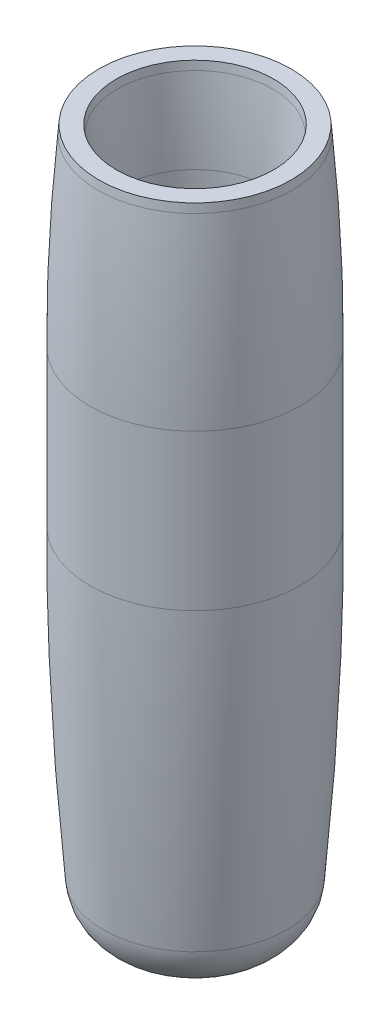
from build123d import *

# Parameters (mm, degrees)
SKETCH1_R           = 6
BOSS_EXTRUDE1_DEPTH = 5
SKETCH2_R           = 6
SKETCH2_R_2         = 4.25
BOSS_EXTRUDE2_DEPTH = 35
CHAMFER1_SIZE       = 1
CHAMFER1_SIZE2      = 11.430052303
FILLET1_R           = 200
CHAMFER2_SIZE       = 0.25
CHAMFER2_SIZE2      = 2.857513076
CHAMFER3_SIZE       = 0.5
CHAMFER3_SIZE2      = 5.715026151
FILLET3_R           = 120
FILLET4_R           = 3


with BuildPart() as part:
    # Sketch1 → Boss-Extrude1 (new body)
    with BuildSketch(Plane(origin=(0, 0, 0), x_dir=(1, 0, 0), z_dir=(0, 1, 0))):
        with Locations(Location((0, 0, 0), (0, 0, 270))):
            Circle(SKETCH1_R)
    extrude(amount=BOSS_EXTRUDE1_DEPTH)

    # Sketch2 → Boss-Extrude2 (add)
    with BuildSketch(Plane(origin=(0, 5, 0), x_dir=(1, 0, 0), z_dir=(0, 1, 0))):
        with Locations(Location((0, 0, 0), (0, 0, 270))):
            Circle(SKETCH2_R)
        with Locations(Location((0, 0, 0), (0, 0, 270))):
            Circle(SKETCH2_R_2, mode=Mode.SUBTRACT)
    extrude(amount=BOSS_EXTRUDE2_DEPTH)

    # Chamfer1
    chamfer1_edges = [part.edges().sort_by_distance(p)[0] for p in [
        (0, 0, -6),
    ]]
    chamfer1_side = [part.faces().sort_by_distance(p)[0] for p in [
        (0, 0, 0),
    ]]
    chamfer(chamfer1_edges, length=CHAMFER1_SIZE, length2=CHAMFER1_SIZE2, reference=chamfer1_side[0])

    # Fillet1
    # the kernel refuses this fillet: 200 mm, written as the material it takes off along each edge
    with BuildSketch(Plane(origin=(0, 11.430052303, 0), x_dir=(0, 0, 1), z_dir=(-1, 0, 0))) as fillet1_piece_1:
        with BuildLine():
            CenterArc((6 - FILLET1_R, FILLET1_R * 0.0436609429085), FILLET1_R, 355, 5)
            Line((6 - FILLET1_R * 0.00380530190825, -FILLET1_R * 0.0434947998391), (6, 0))
            Line((6, 0), (6, FILLET1_R * 0.0436609429085))
        make_face()
    revolve(axis=Axis((0, 11.430052303, 0), (0, 1, 0)), mode=Mode.SUBTRACT)

    # Chamfer2
    chamfer2_edges = [part.edges().sort_by_distance(p)[0] for p in [
        (0, 40, -4.25),
    ]]
    chamfer2_side = [part.faces().sort_by_distance(p)[0] for p in [
        (0, 40, -5.830294373),
    ]]
    chamfer(chamfer2_edges, length=CHAMFER2_SIZE, length2=CHAMFER2_SIZE2, reference=chamfer2_side[0])

    # Fillet2: read off the stored shape, not the designer's step
    # Fillet2 outline → Fillet2 (revolve, cut)
    with BuildSketch(Plane.XY):
        with BuildLine():
            Line((4.25, 39.517302996), (4.25, 34.758599442))
            ThreePointArc((4.25, 34.758599442), (4.301967102, 37.140217992), (4.457769484, 39.517302996))
            Line((4.457769484, 39.517302996), (4.25, 39.517302996))
        make_face()
    revolve(axis=Axis((0, 0, 0), (0, 1, 0)), mode=Mode.SUBTRACT)

    # Chamfer3
    chamfer3_edges = [part.edges().sort_by_distance(p)[0] for p in [
        (0, 40, -6),
    ]]
    chamfer3_side = [part.faces().sort_by_distance(p)[0] for p in [
        (0, 40, -4.669705627),
    ]]
    chamfer(chamfer3_edges, length=CHAMFER3_SIZE, length2=CHAMFER3_SIZE2, reference=chamfer3_side[0])

    # Fillet3
    # the kernel refuses this fillet: 120 mm, written as the material it takes off along each edge
    with BuildSketch(Plane(origin=(0, 34.284973849, 0), x_dir=(0, 0, 1), z_dir=(-1, 0, 0))) as fillet3_piece_1:
        with BuildLine():
            CenterArc((6 - FILLET3_R, -FILLET3_R * 0.0436609429085), FILLET3_R, 0, 5)
            Line((6, -FILLET3_R * 0.0436609429085), (6, 0))
            Line((6, 0), (6 - FILLET3_R * 0.00380530190825, FILLET3_R * 0.0434947998391))
        make_face()
    revolve(axis=Axis((0, 34.284973849, 0), (0, 1, 0)), mode=Mode.SUBTRACT)

    # Fillet4
    # the kernel refuses this fillet: 3 mm, written as the material it takes off along each edge
    with BuildSketch(Plane(origin=(0, 0, 0), x_dir=(0, 0, 1), z_dir=(-1, 0, 0))) as fillet4_piece_1:
        with BuildLine():
            CenterArc((2.251015813, 3), FILLET4_R, 270, 84.857339632)
            Line((2.251015813, 0), (2.251015813, -0.06))
            Line((2.251015813, -0.06), (5, -0.06))
            Line((5, -0.06), (5.059771682, -0.005229345))
            Line((5.059771682, -0.005229345), (5.298698094, 2.725714182))
            Line((5.298698094, 2.725714182), (5.238939618, 2.731092335))
        make_face()
    revolve(axis=Axis((0, 0, 0), (0, 1, 0)), mode=Mode.SUBTRACT)


solid = part.part
